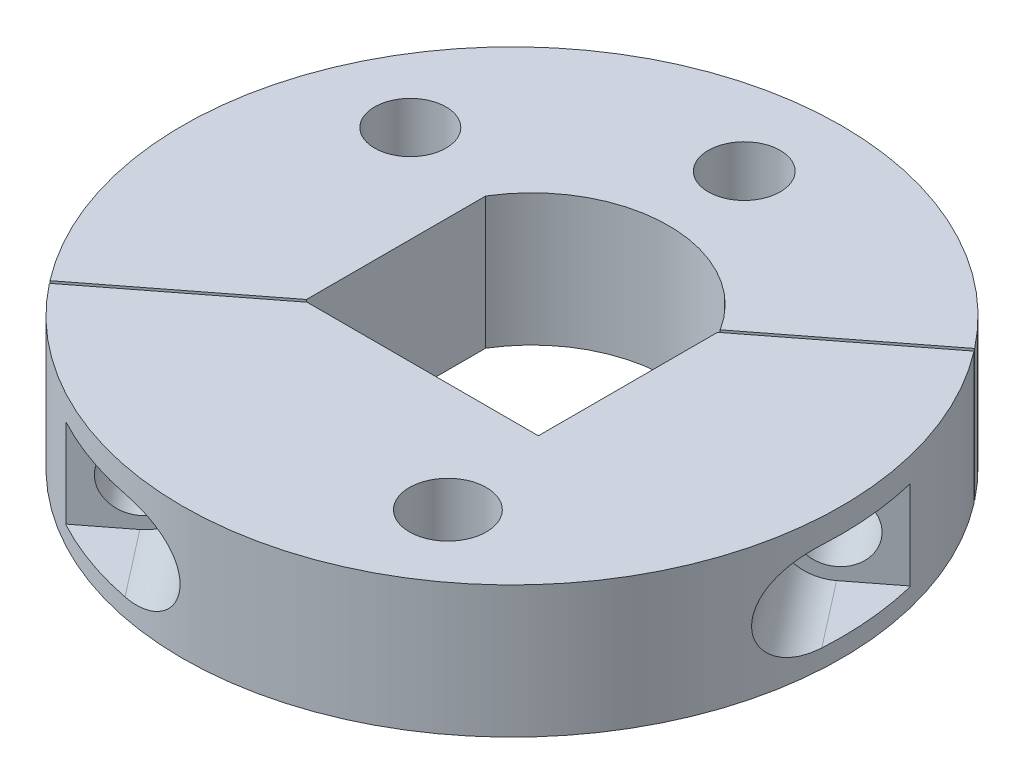
from build123d import *

# Parameters (mm, degrees)
SKETCH1_R               = 25.4
BOSS_EXTRUDE1_DEPTH     = 10.16
CUT_EXTRUDE1_DEPTH      = 38.33022368
CUT_EXTRUDE5_DEPTH      = 38.33022368
CUT_EXTRUDE6_DEPTH      = 48.249547518
CUT_EXTRUDE6_DEPTH_BACK = 48.249547518
SKETCH5_R               = 2.5
CUT_EXTRUDE7_DEPTH      = 48.249547678
SKETCH3_R               = 2.75425671
SKETCH3_R_2             = 2.774310661
SKETCH3_R_3             = 2.967738696
CUT_EXTRUDE8_DEPTH      = 38.330223843


with BuildPart() as part:
    # Sketch1 → Boss-Extrude1 (new body)
    with BuildSketch(Plane(origin=(0, 0, 0), x_dir=(1, 0, 0), z_dir=(0, 1, 0))):
        Circle(SKETCH1_R)
    extrude(amount=BOSS_EXTRUDE1_DEPTH)

    # Sketch2 → Cut-Extrude1 (cut, through all)
    with BuildSketch(Plane(origin=(0, 10.16, 0), x_dir=(1, 0, 0), z_dir=(0, 1, 0))):
        with BuildLine():
            Line((-9.017, -6.985), (9.017, -6.985))
            Line((9.017, -6.985), (9.017, 6.985))
            ThreePointArc((9.017, 6.985), (0, 12.065), (-9.017, 6.985))
            Line((-9.017, 6.985), (-9.017, -6.985))
        make_face()
    extrude(amount=-CUT_EXTRUDE1_DEPTH, mode=Mode.SUBTRACT)

    # Sketch4 → Cut-Extrude5 (cut, through all)
    with BuildSketch(Plane(origin=(0, 10.16, 0), x_dir=(1, 0, 0), z_dir=(0, 1, 0))):
        with BuildLine():
            Line((20.001939718, 15.655108033), (-20.157488744, -15.454308381))
            ThreePointArc((-20.157488744, -15.454308381), (-20.079965232, -15.554902645), (-20.001939718, -15.655108033))
            Line((-20.001939718, -15.655108033), (20.157488744, 15.454308381))
            ThreePointArc((20.157488744, 15.454308381), (20.079965232, 15.554902645), (20.001939718, 15.655108033))
        make_face()
    extrude(amount=-CUT_EXTRUDE5_DEPTH, mode=Mode.SUBTRACT)


with BuildPart() as cut_extrude5_piece_1:
    # of the separate pieces the step leaves, piece 1, a body of its own (cut_extrude5_pieces)
    add(part.part.solids().sort_by_distance((-20.001939718, 0, 15.655108033))[0])


with BuildPart() as cut_extrude5_piece_2:
    # of the separate pieces the step leaves, piece 2, a body of its own (cut_extrude5_pieces)
    add(part.part.solids().sort_by_distance((20.001939718, 0, -15.655108033))[0])


with BuildPart() as cut_extrude6_tool:
    # Sketch5 → Cut-Extrude6 (new, two sides: drawn at the far end of the back side and taken through both)
    with BuildSketch(Plane(origin=(6.299735571, 0, 8.132385919), x_dir=(-0.7905498122844318, 0, 0.6123977419104758), z_dir=(-0.6123977419104758, 0, -0.7905498122844318)).offset(-CUT_EXTRUDE6_DEPTH_BACK)):
        with Locations((-19.138470901, 4.851792793)):
            Circle(SKETCH5_R)
        with Locations((19.138470901, 4.851792793)):
            Circle(SKETCH5_R)
    extrude(amount=CUT_EXTRUDE6_DEPTH + CUT_EXTRUDE6_DEPTH_BACK)


with BuildPart() as cut_extrude5_piece_1_1:
    add(cut_extrude5_piece_1.part)

    # Cut-Extrude6: cut by cut_extrude6_tool
    add(cut_extrude6_tool.part, mode=Mode.SUBTRACT)

    # Sketch6 → Cut-Extrude7 (cut, through all)
    with BuildSketch(Plane(origin=(6.299735571, 0, 8.132385919), x_dir=(-0.7905498122844318, 0, 0.6123977419104758), z_dir=(-0.6123977419104758, 0, -0.7905498122844318))):
        with BuildLine():
            Line((-19.138470901, 1.411515099), (-23.1915317, 1.411515099))
            Line((-23.1915317, 1.411515099), (-23.1915317, 8.292070488))
            Line((-23.1915317, 8.292070488), (-19.138470901, 8.292070488))
            ThreePointArc((-19.138470901, 8.292070488), (-15.698193207, 4.851792793), (-19.138470901, 1.411515099))
        make_face()
        with BuildLine():
            Line((19.138470901, 1.411515099), (23.1915317, 1.411515099))
            Line((23.1915317, 1.411515099), (23.1915317, 8.292070488))
            Line((23.1915317, 8.292070488), (19.138470901, 8.292070488))
            ThreePointArc((19.138470901, 8.292070488), (15.698193207, 4.851792793), (19.138470901, 1.411515099))
        make_face()
    extrude(amount=-CUT_EXTRUDE7_DEPTH, mode=Mode.SUBTRACT)


with BuildPart() as cut_extrude5_piece_2_1:
    add(cut_extrude5_piece_2.part)

    # Cut-Extrude6: cut by cut_extrude6_tool
    add(cut_extrude6_tool.part, mode=Mode.SUBTRACT)


with BuildPart() as cut_extrude8_tool:
    # Sketch3 → Cut-Extrude8 (new, through all)
    with BuildSketch(Plane(origin=(0, 10.16, 0), x_dir=(1, 0, 0), z_dir=(0, 1, 0))):
        with Locations((-16.49263477, 8.655284581)):
            Circle(SKETCH3_R)
        with Locations((-0.713198411, 18.612154654)):
            Circle(SKETCH3_R_2)
        with Locations((10.466163078, -15.407153639)):
            Circle(SKETCH3_R_3)
    extrude(amount=-CUT_EXTRUDE8_DEPTH)


with BuildPart() as cut_extrude5_piece_1_2:
    add(cut_extrude5_piece_1_1.part)

    # Cut-Extrude8: cut by cut_extrude8_tool
    add(cut_extrude8_tool.part, mode=Mode.SUBTRACT)


with BuildPart() as cut_extrude5_piece_2_2:
    add(cut_extrude5_piece_2_1.part)

    # Cut-Extrude8: cut by cut_extrude8_tool
    add(cut_extrude8_tool.part, mode=Mode.SUBTRACT)


solid = Compound([cut_extrude5_piece_1_2.part, cut_extrude5_piece_2_2.part])
